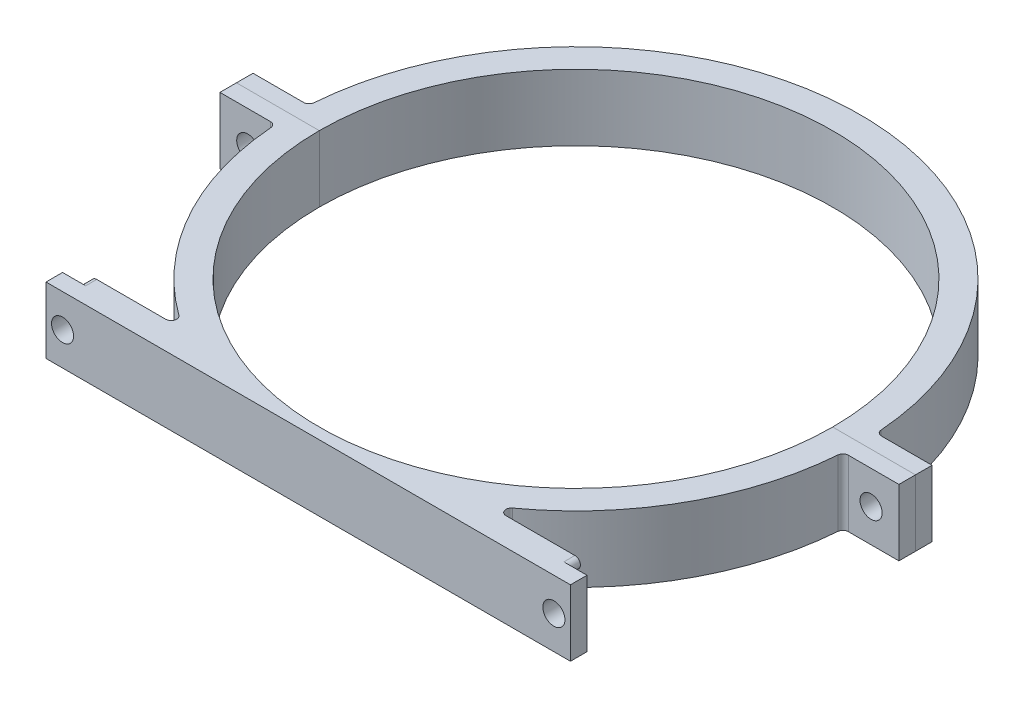
from build123d import *

# Parameters (mm, degrees)
SKETCH1_R           = 46.5
BOSS_EXTRUDE1_DEPTH = 12
SKETCH2_R           = 2
CUT_EXTRUDE1_DEPTH  = 12
SKETCH3_W           = 95
SKETCH3_H           = 5
BOSS_EXTRUDE2_DEPTH = 12
MOVE_FACE1_BY       = 3
MOVE_FACE2_BY       = 3
MOVE_FACE2_2_BY     = 3
SKETCH4_R           = 2
CUT_EXTRUDE2_DEPTH  = 114.80355882
CUT_EXTRUDE3_DEPTH  = 2
FILLET1_R           = 1
FILLET2_R           = 1


with BuildPart() as part:
    # Sketch1 → Boss-Extrude1 (new body)
    with BuildSketch(Plane(origin=(0, 0, 0), x_dir=(1, 0, 0), z_dir=(0, 1, 0))):
        with BuildLine():
            Line((61.5, -3), (61.5, 3))
            Line((61.5, 3), (51.412547107, 3))
            ThreePointArc((51.412547107, 3), (0, 51.5), (-51.412547107, 3))
            Line((-51.412547107, 3), (-61.5, 3))
            Line((-61.5, 3), (-61.5, -3))
            Line((-61.5, -3), (-51.412547107, -3))
            ThreePointArc((-51.412547107, -3), (0, -51.5), (51.412547107, -3))
            Line((51.412547107, -3), (61.5, -3))
        make_face()
        Circle(SKETCH1_R, mode=Mode.SUBTRACT)
    extrude(amount=BOSS_EXTRUDE1_DEPTH)

    # Sketch2 → Cut-Extrude1 (cut)
    with BuildSketch(Plane.XY.offset(3)):
        with Locations((56.456273553, 6)):
            Circle(SKETCH2_R)
        with Locations((-56.456273553, 6)):
            Circle(SKETCH2_R)
    extrude(amount=-CUT_EXTRUDE1_DEPTH, mode=Mode.SUBTRACT)


with BuildPart() as body_2:
    # Split1: the piece on the far side of the plane
    add(part.part)
    split(bisect_by=Plane.XY, keep=Keep.BOTTOM)

    # Fillet2
    fillet2_edges = [body_2.edges().sort_by_distance(p)[0] for p in [
        (-51.412547107, 6, -3),
        (51.412547107, 6, -3),
    ]]
    fillet(fillet2_edges, radius=FILLET2_R)


with BuildPart() as part_1:
    add(part.part)

    # Split1
    split(bisect_by=Plane.XY, keep=Keep.TOP)

    # Sketch3 → Boss-Extrude2 (add)
    with BuildSketch(Plane(origin=(0, 12, 0), x_dir=(1, 0, 0), z_dir=(0, 1, 0))):
        with Locations((0, -49)):
            Rectangle(SKETCH3_W, SKETCH3_H)
    extrude(amount=-BOSS_EXTRUDE2_DEPTH)

    # Move Face1: a face moved inward by 3.0
    extrude(part_1.faces().sort_by_distance((0, 6, 51.5))[0], amount=MOVE_FACE1_BY, dir=(0, 0, -1), mode=Mode.SUBTRACT)

    # Move Face2: a face moved outward by 3.0
    extrude(part_1.faces().sort_by_distance((34.817971811, 6, 46.5))[0], amount=MOVE_FACE2_BY, dir=(0, 0, -1))

    # Move Face2 2: a face moved outward by 3.0
    extrude(part_1.faces().sort_by_distance((-34.817971811, 6, 46.5))[0], amount=MOVE_FACE2_2_BY, dir=(0, 0, -1))

    # Sketch4 → Cut-Extrude2 (cut, through all)
    with BuildSketch(Plane(origin=(0, 0, 43.5), x_dir=(-1, 0, 0), z_dir=(0, 0, -1))):
        with Locations((44.5, 6)):
            Circle(SKETCH4_R)
    cut_extrude2 = extrude(amount=-CUT_EXTRUDE2_DEPTH, mode=Mode.SUBTRACT)

    # Sketch5 → Cut-Extrude3 (cut)
    with BuildSketch(Plane(origin=(0, 0, 43.5), x_dir=(-1, 0, 0), z_dir=(0, 0, -1))):
        with BuildLine():
            Line((47.5, 12), (42.69457877, 9.569377282))
            ThreePointArc((42.69457877, 9.569377282), (40.5, 6), (42.69457877, 2.430622718))
            Line((42.69457877, 2.430622718), (47.5, 0))
            Line((47.5, 0), (47.5, 12))
        make_face()
    cut_extrude3 = extrude(amount=-CUT_EXTRUDE3_DEPTH, mode=Mode.SUBTRACT)

    # Mirror1: Cut-Extrude2, Cut-Extrude3 across plane
    add(cut_extrude2.mirror(Plane(origin=(0, 0, 0), x_dir=(0, 0, 1), z_dir=(1, 0, 0))), mode=Mode.SUBTRACT)
    add(cut_extrude3.mirror(Plane(origin=(0, 0, 0), x_dir=(0, 0, 1), z_dir=(1, 0, 0))), mode=Mode.SUBTRACT)

    # Fillet1
    fillet1_edges = [part_1.edges().sort_by_distance(p)[0] for p in [
        (-51.412547107, 6, 3),
        (51.412547107, 6, 3),
        (47.5, 0, 44.5),
        (47.5, 12, 44.5),
        (-27.568097504, 6, 43.5),
        (27.568097504, 6, 43.5),
        (-47.5, 12, 44.5),
        (-47.5, 0, 44.5),
    ]]
    fillet(fillet1_edges, radius=FILLET1_R)


solid = Compound([body_2.part, part_1.part])
